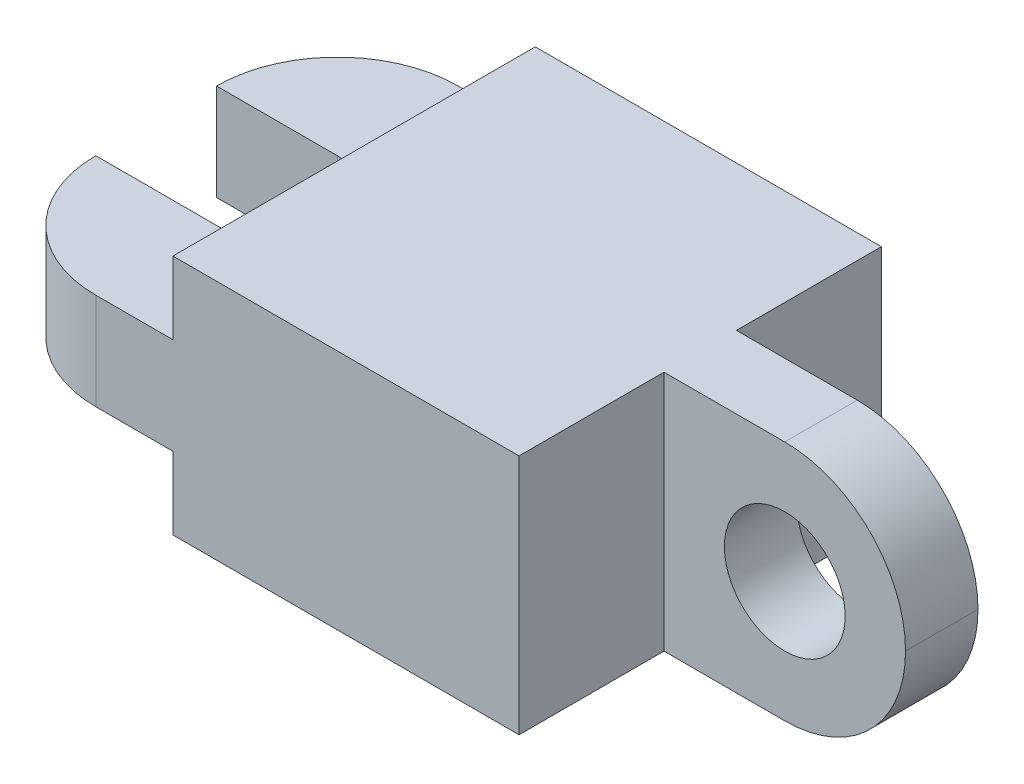
from build123d import *

# Parameters (mm, degrees)
BOSS_EXTRUDE1_DEPTH      = 50
BOSS_EXTRUDE1_DEPTH_BACK = 50
FILLET1_R                = 50
CUT_EXTRUDE1_DEPTH       = 298.062325719
CUT_EXTRUDE1_DEPTH_BACK  = 298.062325719
HOLE1_D                  = 50


with BuildPart() as part:
    # Sketch1 → Boss-Extrude1 (new, two sides: drawn at the far end of the back side and taken through both)
    with BuildSketch(Plane(origin=(0, 0, 0), x_dir=(1, 0, 0), z_dir=(0, 1, 0)).offset(-BOSS_EXTRUDE1_DEPTH_BACK)):
        with BuildLine():
            Line((-50, -25), (0, -25))
            ThreePointArc((0, -25), (25, 0), (0, 25))
            Line((0, 25), (-50, 25))
            ThreePointArc((-50, 25), (-35.355339059, 60.355339059), (0, 75))
            Line((0, 75), (175.219958145, 75))
            Line((175.219958145, 75), (175.219958145, 15))
            Line((175.219958145, 15), (275.219958145, 15))
            Line((275.219958145, 15), (275.219958145, -15))
            Line((275.219958145, -15), (175.219958145, -15))
            Line((175.219958145, -15), (175.219958145, -75))
            Line((175.219958145, -75), (0, -75))
            ThreePointArc((0, -75), (-35.355339059, -60.355339059), (-50, -25))
        make_face()
    extrude(amount=BOSS_EXTRUDE1_DEPTH + BOSS_EXTRUDE1_DEPTH_BACK)

    # Fillet1
    fillet1_edges = [part.edges().sort_by_distance(p)[0] for p in [
        (275.219958145, 50, 0),
        (275.219958145, -50, 0),
    ]]
    fillet(fillet1_edges, radius=FILLET1_R - 0.0001)  # a hair under: the kernel refuses the full size

    # Sketch4 → Cut-Extrude1 (cut, two sides: drawn at the far end of the back side and taken through both)
    with BuildSketch(Plane(origin=(0, 0, 25), x_dir=(-1, 0, 0), z_dir=(0, 0, -1)).offset(-CUT_EXTRUDE1_DEPTH_BACK)):
        Polygon((0, 20), (50, 20), (50, 50), (0, 50), (-31.919958145, 50), (-31.919958145, 20), align=None)
        Polygon((0, -20), (50, -20), (50, -50), (0, -50), (-31.919958145, -50), (-31.919958145, -20), align=None)
    extrude(amount=CUT_EXTRUDE1_DEPTH + CUT_EXTRUDE1_DEPTH_BACK, mode=Mode.SUBTRACT)

    # Hole1 (through all)
    with Locations(Plane(origin=(0, 0, -15), x_dir=(-1, 0, 0), z_dir=(0, 0, -1))):
        with Locations((-225.219958145, 0)):
            Hole(HOLE1_D / 2)


solid = part.part
